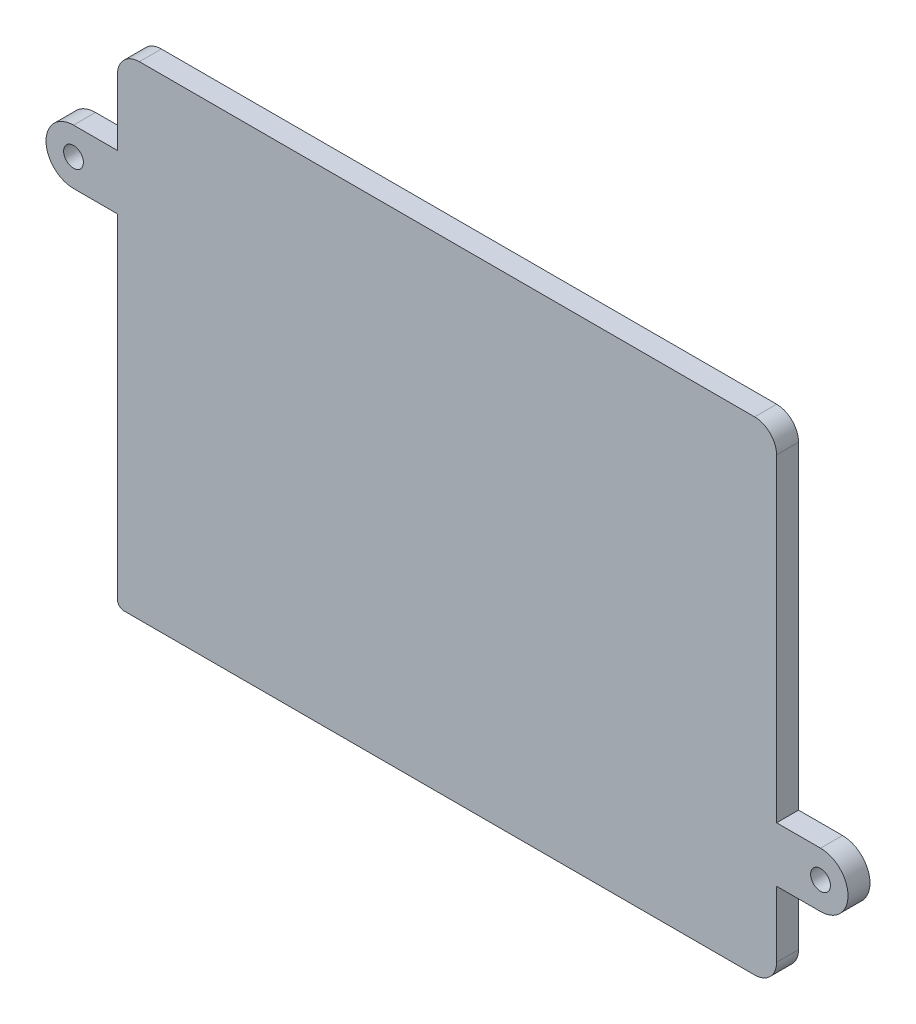
from build123d import *

# Parameters (mm, degrees)
SKETCH1_R           = 2.25
BOSS_EXTRUDE1_DEPTH = 5
BOSS_EXTRUDE2_DEPTH = 2


with BuildPart() as part:
    # Sketch1 → Boss-Extrude1 (new body)
    with BuildSketch(Plane.XY):
        with BuildLine():
            Line((-75, 35), (-85, 35))
            ThreePointArc((-85, 35), (-91.25, 28.75), (-85, 22.5))
            Line((-85, 22.5), (-75, 22.5))
            Line((-75, 22.5), (-75, -53.5))
            ThreePointArc((-75, -53.5), (-74.560660172, -54.560660172), (-73.5, -55))
            Line((-73.5, -55), (70, -55))
            ThreePointArc((70, -55), (73.535533906, -53.535533906), (75, -50))
            Line((75, -50), (75, -35))
            Line((75, -35), (85, -35))
            ThreePointArc((85, -35), (91.25, -28.75), (85, -22.5))
            Line((85, -22.5), (75, -22.5))
            Line((75, -22.5), (75, 50))
            ThreePointArc((75, 50), (73.535533906, 53.535533906), (70, 55))
            Line((70, 55), (-70, 55))
            ThreePointArc((-70, 55), (-73.535533906, 53.535533906), (-75, 50))
            Line((-75, 50), (-75, 35))
        make_face()
        with Locations((85, -28.75)):
            Circle(SKETCH1_R, mode=Mode.SUBTRACT)
        with Locations((-85, 28.75)):
            Circle(SKETCH1_R, mode=Mode.SUBTRACT)
    extrude(amount=BOSS_EXTRUDE1_DEPTH)

    # Sketch3 → Boss-Extrude2 (add)
    with BuildSketch(Plane.XY):
        with BuildLine():
            ThreePointArc((-65, 48.5), (-67.474873734, 47.474873734), (-68.5, 45))
            Line((-68.5, 45), (-68.5, -45))
            ThreePointArc((-68.5, -45), (-67.474873734, -47.474873734), (-65, -48.5))
            Line((-65, -48.5), (65, -48.5))
            ThreePointArc((65, -48.5), (67.474873734, -47.474873734), (68.5, -45))
            Line((68.5, -45), (68.5, 45))
            ThreePointArc((68.5, 45), (67.474873734, 47.474873734), (65, 48.5))
            Line((65, 48.5), (-65, 48.5))
        make_face()
    extrude(amount=-BOSS_EXTRUDE2_DEPTH)


solid = part.part
